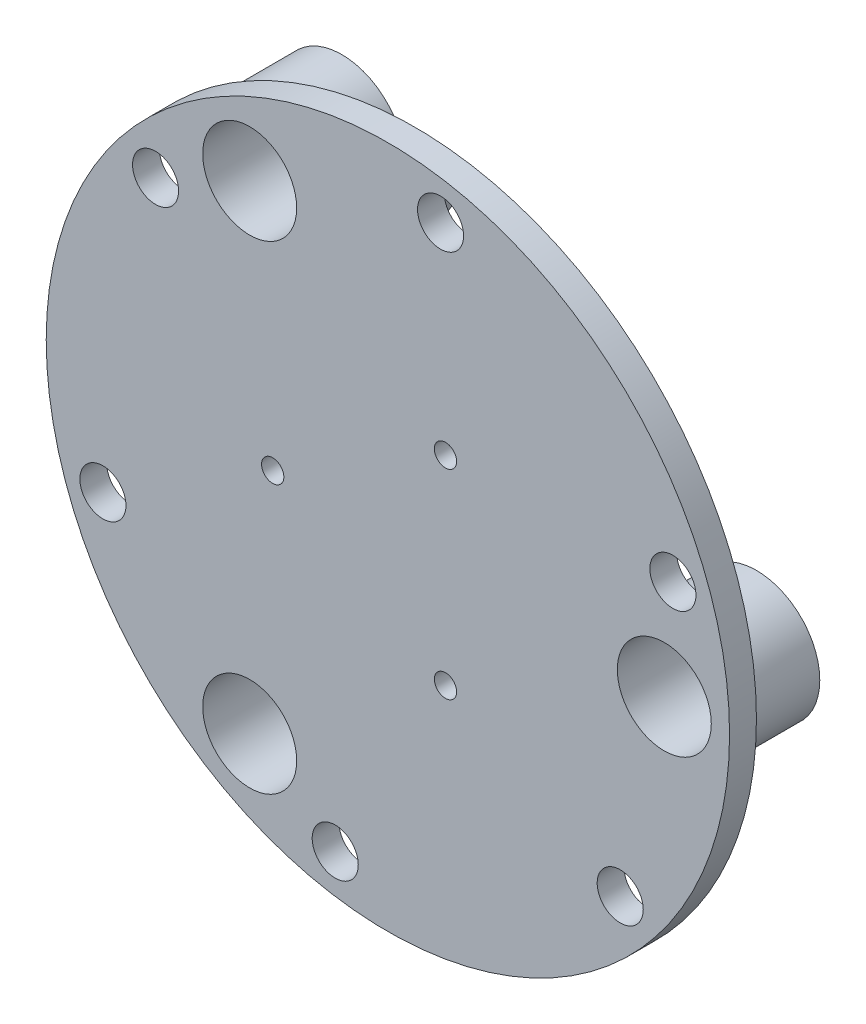
from build123d import *

# Parameters (mm, degrees)
F_01_START                                = 33.5
S01_JOINING_CENTRE_OF_FLOATING_Y_R        = 9
F_01_JOINING_CENTRE_OF_FLOATING_Y_DEPTH   = 3.5
F_02_START                                = 33.5
F_02_FLOATING_SPOKE_1_DEPTH               = 3.5
F_03_START                                = 33.5
F_03_FLOATING_SPOKE_2_DEPTH               = 3.5
F_04_START                                = 33.5
F_04_FLOATING_SPOKE_3_DEPTH               = 3.5
F_05_START                                = 33.5
F_05_MOVING_TENDON_TIE_WEB_1_DEPTH        = 3.5
F_06_START                                = 29.8
S06_TENDON_ANCHOR_BASE_1_R                = 4.2
F_06_TENDON_ANCHOR_BASE_1_DEPTH           = 3.7
F_07_START                                = 28
S07_TENDON_MOUTH_1_R                      = 3.15
F_07_TENDON_MOUTH_1_DEPTH                 = 1.8
F_08_START                                = 33.5
F_08_MOVING_TENDON_TIE_WEB_2_DEPTH        = 3.5
F_09_START                                = 29.8
S09_TENDON_ANCHOR_BASE_2_R                = 4.2
F_09_TENDON_ANCHOR_BASE_2_DEPTH           = 3.7
F_10_START                                = 28
S10_TENDON_MOUTH_2_R                      = 3.15
F_10_TENDON_MOUTH_2_DEPTH                 = 1.8
F_11_START                                = 33.5
F_11_MOVING_TENDON_TIE_WEB_3_DEPTH        = 3.5
F_12_START                                = 29.8
S12_TENDON_ANCHOR_BASE_3_R                = 4.2
F_12_TENDON_ANCHOR_BASE_3_DEPTH           = 3.7
F_13_START                                = 28
S13_TENDON_MOUTH_3_R                      = 3.15
F_13_TENDON_MOUTH_3_DEPTH                 = 1.8
F_14_START                                = 33.5
S14_JOINED_DRIVE_HOOP_R                   = 44.5
F_14_JOINED_DRIVE_HOOP_DEPTH              = 3.5
F_15_START                                = 25
S15_SLIDING_GUIDE_BARREL_1_R              = 8.25
F_15_SLIDING_GUIDE_BARREL_1_DEPTH         = 12
F_16_START                                = 25
S16_SLIDING_GUIDE_BARREL_2_R              = 8.25
F_16_SLIDING_GUIDE_BARREL_2_DEPTH         = 12
F_17_START                                = 25
S17_SLIDING_GUIDE_BARREL_3_R              = 8.25
F_17_SLIDING_GUIDE_BARREL_3_DEPTH         = 12
F_18_START                                = 24
S18_GUIDE_BUSHING_SEATS_R                 = 6.12
F_18_GUIDE_BUSHING_SEATS_DEPTH            = 14
F_19_START                                = 27.8
S19_THROUGH_TENDON_TIE_EYES_R             = 1.45
F_19_THROUGH_TENDON_TIE_EYES_DEPTH        = 10
F_20_START                                = -7.2
F_20_INTEGRAL_B1_FORK_CHEEK_L_DEPTH       = 3.6
F_21_START                                = 3.6
F_21_INTEGRAL_B1_FORK_CHEEK_R_DEPTH       = 3.6
F_22_START                                = -7.5
S22_B1_PIVOT_THROUGH_BOTH_CHEEKS_R        = 1.65
F_22_B1_PIVOT_THROUGH_BOTH_CHEEKS_DEPTH   = 15
F_23_START                                = -7.3
S23_B1_RECESSED_PIVOT_SCREW_HEAD_R        = 2.7
F_23_B1_RECESSED_PIVOT_SCREW_HEAD_DEPTH   = 1.5
F_24_START                                = -7.2
F_24_INTEGRAL_B2_FORK_CHEEK_L_DEPTH       = 3.6
F_25_START                                = 3.6
F_25_INTEGRAL_B2_FORK_CHEEK_R_DEPTH       = 3.6
F_26_START                                = -7.5
S26_B2_PIVOT_THROUGH_BOTH_CHEEKS_R        = 2.6
F_26_B2_PIVOT_THROUGH_BOTH_CHEEKS_DEPTH   = 15
F_27_START                                = -7.3
S27_B2_RECESSED_PIVOT_SCREW_HEAD_R        = 2.7
F_27_B2_RECESSED_PIVOT_SCREW_HEAD_DEPTH   = 1.5
F_28_START                                = -7.2
F_28_INTEGRAL_B3_FORK_CHEEK_L_DEPTH       = 3.6
F_29_START                                = 3.6
F_29_INTEGRAL_B3_FORK_CHEEK_R_DEPTH       = 3.6
F_30_START                                = -7.5
S30_B3_PIVOT_THROUGH_BOTH_CHEEKS_R        = 2.6
F_30_B3_PIVOT_THROUGH_BOTH_CHEEKS_DEPTH   = 15
F_31_START                                = -7.3
S31_B3_RECESSED_PIVOT_SCREW_HEAD_R        = 2.7
F_31_B3_RECESSED_PIVOT_SCREW_HEAD_DEPTH   = 1.5
CUT_EXTRUDE1_DEPTH                        = 74.425869509
CUT_EXTRUDE1_DEPTH_BACK                   = 16
SKETCH1_R                                 = 2.6
FORK_INNER_FACES_8_40_MM_LUG_CLEARANCE_BY = 0.6
FORK_INNER_FACES_8_40_MM_LUG_CLEAR_2_BY   = 0.6
FORK_INNER_FACES_8_40_MM_LUG_CLEAR_3_BY   = 0.6
FORK_INNER_FACES_8_40_MM_LUG_CLEAR_4_BY   = 0.6
FORK_INNER_FACES_8_40_MM_LUG_CLEAR_5_BY   = 0.6
FORK_INNER_FACES_8_40_MM_LUG_CLEAR_6_BY   = 0.6
SIX_START                                 = 37.1
SIX_6_MM_HOLES_ON_79_MM_PITCH_CIRCLE_R    = 3
SIX_LIGHTENING_HOLES_AT_60_DEGREES_DEPTH  = 3.7
CENTRAL_START                             = 30.55
CENTRAL_SIX_SIDED_RIB_JUNCTION_DEPTH      = 3


with BuildPart() as part:
    # S01 - Joining centre of floating Y → 01 - Joining centre of floating Y (new body)
    with BuildSketch(Plane.XY.offset(F_01_START)):
        Circle(S01_JOINING_CENTRE_OF_FLOATING_Y_R)
    extrude(amount=F_01_JOINING_CENTRE_OF_FLOATING_Y_DEPTH)

    # S02 - Floating spoke 1 → 02 - Floating spoke 1 (add)
    with BuildSketch(Plane.XY.offset(F_02_START)):
        with BuildLine():
            Line((4.65, -8.054036255), (-21.330762114, -23.054036255))
            ThreePointArc((-21.330762114, -23.054036255), (-34.034798369, -19.65), (-30.630762114, -6.945963745))
            Line((-30.630762114, -6.945963745), (-4.65, 8.054036255))
            ThreePointArc((-4.65, 8.054036255), (8.054036255, 4.65), (4.65, -8.054036255))
        make_face()
    extrude(amount=F_02_FLOATING_SPOKE_1_DEPTH)

    # S03 - Floating spoke 2 → 03 - Floating spoke 2 (add)
    with BuildSketch(Plane.XY.offset(F_03_START)):
        with BuildLine():
            Line((4.65, 8.054036255), (30.630762114, -6.945963745))
            ThreePointArc((30.630762114, -6.945963745), (34.034798369, -19.65), (21.330762114, -23.054036255))
            Line((21.330762114, -23.054036255), (-4.65, -8.054036255))
            ThreePointArc((-4.65, -8.054036255), (-8.054036255, 4.65), (4.65, 8.054036255))
        make_face()
    extrude(amount=F_03_FLOATING_SPOKE_2_DEPTH)

    # S04 - Floating spoke 3 → 04 - Floating spoke 3 (add)
    with BuildSketch(Plane.XY.offset(F_04_START)):
        with BuildLine():
            Line((-9.3, 0), (-9.3, 30))
            ThreePointArc((-9.3, 30), (0, 39.3), (9.3, 30))
            Line((9.3, 30), (9.3, 0))
            ThreePointArc((9.3, 0), (0, -9.3), (-9.3, 0))
        make_face()
    extrude(amount=F_04_FLOATING_SPOKE_3_DEPTH)

    # S05 - Moving tendon tie web 1 → 05 - Moving tendon tie web 1 (add)
    with BuildSketch(Plane.XY.offset(F_05_START)):
        with BuildLine():
            Line((25.299707774, -21.263079513), (6.818945661, -19.25346057))
            ThreePointArc((6.818945661, -19.25346057), (1.236920487, -12.309326717), (8.181054339, -6.727301544))
            Line((8.181054339, -6.727301544), (26.661816453, -8.736920487))
            ThreePointArc((26.661816453, -8.736920487), (32.243841627, -15.681054339), (25.299707774, -21.263079513))
        make_face()
    extrude(amount=F_05_MOVING_TENDON_TIE_WEB_1_DEPTH)

    # S06 - Tendon anchor base 1 → 06 - Tendon anchor base 1 (add)
    with BuildSketch(Plane.XY.offset(F_06_START)):
        with Locations((7.5, -12.990381057)):
            Circle(S06_TENDON_ANCHOR_BASE_1_R)
    extrude(amount=F_06_TENDON_ANCHOR_BASE_1_DEPTH)

    # S07 - Tendon mouth 1 → 07 - Tendon mouth 1 (add)
    with BuildSketch(Plane.XY.offset(F_07_START)):
        with Locations((7.5, -12.990381057)):
            Circle(S07_TENDON_MOUTH_1_R)
    extrude(amount=F_07_TENDON_MOUTH_1_DEPTH)

    # S08 - Moving tendon tie web 2 → 08 - Moving tendon tie web 2 (add)
    with BuildSketch(Plane.XY.offset(F_08_START)):
        with BuildLine():
            Line((5.764513134, 32.541729397), (13.264513134, 15.532110454))
            ThreePointArc((13.264513134, 15.532110454), (10.041729397, 7.225867923), (1.735486866, 10.448651659))
            Line((1.735486866, 10.448651659), (-5.764513134, 27.458270603))
            ThreePointArc((-5.764513134, 27.458270603), (-2.541729397, 35.764513134), (5.764513134, 32.541729397))
        make_face()
    extrude(amount=F_08_MOVING_TENDON_TIE_WEB_2_DEPTH)

    # S09 - Tendon anchor base 2 → 09 - Tendon anchor base 2 (add)
    with BuildSketch(Plane.XY.offset(F_09_START)):
        with Locations((7.5, 12.990381057)):
            Circle(S09_TENDON_ANCHOR_BASE_2_R)
    extrude(amount=F_09_TENDON_ANCHOR_BASE_2_DEPTH)

    # S10 - Tendon mouth 2 → 10 - Tendon mouth 2 (add)
    with BuildSketch(Plane.XY.offset(F_10_START)):
        with Locations((7.5, 12.990381057)):
            Circle(S10_TENDON_MOUTH_2_R)
    extrude(amount=F_10_TENDON_MOUTH_2_DEPTH)

    # S11 - Moving tendon tie web 3 → 11 - Moving tendon tie web 3 (add)
    with BuildSketch(Plane.XY.offset(F_11_START)):
        with BuildLine():
            Line((-31.064220908, -11.278649884), (-20.083458795, 3.721350116))
            ThreePointArc((-20.083458795, 3.721350116), (-11.278649884, 5.083458795), (-9.916541205, -3.721350116))
            Line((-9.916541205, -3.721350116), (-20.897303319, -18.721350116))
            ThreePointArc((-20.897303319, -18.721350116), (-29.702112229, -20.083458795), (-31.064220908, -11.278649884))
        make_face()
    extrude(amount=F_11_MOVING_TENDON_TIE_WEB_3_DEPTH)

    # S12 - Tendon anchor base 3 → 12 - Tendon anchor base 3 (add)
    with BuildSketch(Plane.XY.offset(F_12_START)):
        with Locations((-15, 0)):
            Circle(S12_TENDON_ANCHOR_BASE_3_R)
    extrude(amount=F_12_TENDON_ANCHOR_BASE_3_DEPTH)

    # S13 - Tendon mouth 3 → 13 - Tendon mouth 3 (add)
    with BuildSketch(Plane.XY.offset(F_13_START)):
        with Locations((-15, 0)):
            Circle(S13_TENDON_MOUTH_3_R)
    extrude(amount=F_13_TENDON_MOUTH_3_DEPTH)

    # S14 - Joined drive hoop → 14 - Joined drive hoop (add)
    with BuildSketch(Plane.XY.offset(F_14_START)):
        Circle(S14_JOINED_DRIVE_HOOP_R)
    extrude(amount=F_14_JOINED_DRIVE_HOOP_DEPTH)

    # S15 - Sliding guide barrel 1 → 15 - Sliding guide barrel 1 (add)
    with BuildSketch(Plane.XY.offset(F_15_START)):
        with Locations((36, 0)):
            Circle(S15_SLIDING_GUIDE_BARREL_1_R)
    extrude(amount=F_15_SLIDING_GUIDE_BARREL_1_DEPTH)

    # S16 - Sliding guide barrel 2 → 16 - Sliding guide barrel 2 (add)
    with BuildSketch(Plane.XY.offset(F_16_START)):
        with Locations((-18, 31.176914536)):
            Circle(S16_SLIDING_GUIDE_BARREL_2_R)
    extrude(amount=F_16_SLIDING_GUIDE_BARREL_2_DEPTH)

    # S17 - Sliding guide barrel 3 → 17 - Sliding guide barrel 3 (add)
    with BuildSketch(Plane.XY.offset(F_17_START)):
        with Locations((-18, -31.176914536)):
            Circle(S17_SLIDING_GUIDE_BARREL_3_R)
    extrude(amount=F_17_SLIDING_GUIDE_BARREL_3_DEPTH)

    # S18 - Guide bushing seats → 18 - Guide bushing seats (cut)
    with BuildSketch(Plane.XY.offset(F_18_START)):
        with Locations((36, 0)):
            Circle(S18_GUIDE_BUSHING_SEATS_R)
        with Locations((-18, 31.176914536)):
            Circle(S18_GUIDE_BUSHING_SEATS_R)
        with Locations((-18, -31.176914536)):
            Circle(S18_GUIDE_BUSHING_SEATS_R)
    extrude(amount=F_18_GUIDE_BUSHING_SEATS_DEPTH, mode=Mode.SUBTRACT)

    # S19 - Through tendon tie eyes → 19 - Through tendon tie eyes (cut)
    with BuildSketch(Plane.XY.offset(F_19_START)):
        with Locations((7.5, -12.990381057)):
            Circle(S19_THROUGH_TENDON_TIE_EYES_R)
        with Locations((7.5, 12.990381057)):
            Circle(S19_THROUGH_TENDON_TIE_EYES_R)
        with Locations((-15, 0)):
            Circle(S19_THROUGH_TENDON_TIE_EYES_R)
    extrude(amount=F_19_THROUGH_TENDON_TIE_EYES_DEPTH, mode=Mode.SUBTRACT)

    # S20 - Integral B1 fork cheek L → 20 - Integral B1 fork cheek L (add)
    with BuildSketch(Plane(origin=(2.009618943, -7.5, 0), x_dir=(0.9659258262890683, 0.2588190451025208, 0), z_dir=(-0.2588190451025208, 0.9659258262890684, 0)).offset(F_20_START)):
        with BuildLine():
            Line((-35.077774789, -34.5), (-22.877774789, -34.5))
            Line((-22.877774789, -34.5), (-24.027774789, -28))
            ThreePointArc((-24.027774789, -28), (-28.977774789, -23.05), (-33.927774789, -28))
            Line((-33.927774789, -28), (-35.077774789, -34.5))
        make_face()
    extrude(amount=F_20_INTEGRAL_B1_FORK_CHEEK_L_DEPTH)

    # S21 - Integral B1 fork cheek R → 21 - Integral B1 fork cheek R (add)
    with BuildSketch(Plane(origin=(2.009618943, -7.5, 0), x_dir=(0.9659258262890683, 0.2588190451025208, 0), z_dir=(-0.2588190451025208, 0.9659258262890684, 0)).offset(F_21_START)):
        with BuildLine():
            Line((-35.077774789, -34.5), (-22.877774789, -34.5))
            Line((-22.877774789, -34.5), (-24.027774789, -28))
            ThreePointArc((-24.027774789, -28), (-28.977774789, -23.05), (-33.927774789, -28))
            Line((-33.927774789, -28), (-35.077774789, -34.5))
        make_face()
    extrude(amount=F_21_INTEGRAL_B1_FORK_CHEEK_R_DEPTH)

    # S22 - B1 pivot through both cheeks → 22 - B1 pivot through both cheeks (cut)
    with BuildSketch(Plane(origin=(2.009618943, -7.5, 0), x_dir=(0.9659258262890683, 0.2588190451025208, 0), z_dir=(-0.2588190451025208, 0.9659258262890684, 0)).offset(F_22_START)):
        with Locations((-28.977774789, -28)):
            Circle(S22_B1_PIVOT_THROUGH_BOTH_CHEEKS_R)
    extrude(amount=F_22_B1_PIVOT_THROUGH_BOTH_CHEEKS_DEPTH, mode=Mode.SUBTRACT)

    # S23 - B1 recessed pivot screw head → 23 - B1 recessed pivot screw head (cut)
    with BuildSketch(Plane(origin=(2.009618943, -7.5, 0), x_dir=(0.9659258262890683, 0.2588190451025208, 0), z_dir=(-0.2588190451025208, 0.9659258262890684, 0)).offset(F_23_START)):
        with Locations((-28.977774789, -28)):
            Circle(S23_B1_RECESSED_PIVOT_SCREW_HEAD_R)
    extrude(amount=F_23_B1_RECESSED_PIVOT_SCREW_HEAD_DEPTH, mode=Mode.SUBTRACT)

    # S24 - Integral B2 fork cheek L → 24 - Integral B2 fork cheek L (add)
    with BuildSketch(Plane(origin=(5.490381057, 5.490381057, 0), x_dir=(0, 0, 1), z_dir=(-0.7071067811865476, -0.7071067811865475, 0)).offset(F_24_START)):
        with BuildLine():
            Line((34.5, -35.077774789), (34.5, -22.877774789))
            Line((34.5, -22.877774789), (28, -24.027774789))
            ThreePointArc((28, -24.027774789), (23.05, -28.977774789), (28, -33.927774789))
            Line((28, -33.927774789), (34.5, -35.077774789))
        make_face()
    extrude(amount=F_24_INTEGRAL_B2_FORK_CHEEK_L_DEPTH)

    # S25 - Integral B2 fork cheek R → 25 - Integral B2 fork cheek R (add)
    with BuildSketch(Plane(origin=(5.490381057, 5.490381057, 0), x_dir=(0, 0, 1), z_dir=(-0.7071067811865476, -0.7071067811865475, 0)).offset(F_25_START)):
        with BuildLine():
            Line((34.5, -35.077774789), (34.5, -22.877774789))
            Line((34.5, -22.877774789), (28, -24.027774789))
            ThreePointArc((28, -24.027774789), (23.05, -28.977774789), (28, -33.927774789))
            Line((28, -33.927774789), (34.5, -35.077774789))
        make_face()
    extrude(amount=F_25_INTEGRAL_B2_FORK_CHEEK_R_DEPTH)

    # S26 - B2 pivot through both cheeks → 26 - B2 pivot through both cheeks (cut)
    with BuildSketch(Plane(origin=(5.490381057, 5.490381057, 0), x_dir=(0, 0, 1), z_dir=(-0.7071067811865476, -0.7071067811865475, 0)).offset(F_26_START)):
        with Locations((28, -28.977774789)):
            Circle(S26_B2_PIVOT_THROUGH_BOTH_CHEEKS_R)
    extrude(amount=F_26_B2_PIVOT_THROUGH_BOTH_CHEEKS_DEPTH, mode=Mode.SUBTRACT)

    # S27 - B2 recessed pivot screw head → 27 - B2 recessed pivot screw head (cut)
    with BuildSketch(Plane(origin=(5.490381057, 5.490381057, 0), x_dir=(0, 0, 1), z_dir=(-0.7071067811865476, -0.7071067811865475, 0)).offset(F_27_START)):
        with Locations((28, -28.977774789)):
            Circle(S27_B2_RECESSED_PIVOT_SCREW_HEAD_R)
    extrude(amount=F_27_B2_RECESSED_PIVOT_SCREW_HEAD_DEPTH, mode=Mode.SUBTRACT)

    # S28 - Integral B3 fork cheek L → 28 - Integral B3 fork cheek L (add)
    with BuildSketch(Plane(origin=(-7.5, 2.009618943, 0), x_dir=(0, 0, -1), z_dir=(0.9659258262890683, -0.25881904510252113, 0)).offset(F_28_START)):
        with BuildLine():
            Line((-34.5, 35.077774789), (-34.5, 22.877774789))
            Line((-34.5, 22.877774789), (-28, 24.027774789))
            ThreePointArc((-28, 24.027774789), (-23.05, 28.977774789), (-28, 33.927774789))
            Line((-28, 33.927774789), (-34.5, 35.077774789))
        make_face()
    extrude(amount=F_28_INTEGRAL_B3_FORK_CHEEK_L_DEPTH)

    # S29 - Integral B3 fork cheek R → 29 - Integral B3 fork cheek R (add)
    with BuildSketch(Plane(origin=(-7.5, 2.009618943, 0), x_dir=(0, 0, -1), z_dir=(0.9659258262890683, -0.25881904510252113, 0)).offset(F_29_START)):
        with BuildLine():
            Line((-34.5, 35.077774789), (-34.5, 22.877774789))
            Line((-34.5, 22.877774789), (-28, 24.027774789))
            ThreePointArc((-28, 24.027774789), (-23.05, 28.977774789), (-28, 33.927774789))
            Line((-28, 33.927774789), (-34.5, 35.077774789))
        make_face()
    extrude(amount=F_29_INTEGRAL_B3_FORK_CHEEK_R_DEPTH)

    # S30 - B3 pivot through both cheeks → 30 - B3 pivot through both cheeks (cut)
    with BuildSketch(Plane(origin=(-7.5, 2.009618943, 0), x_dir=(0, 0, -1), z_dir=(0.9659258262890683, -0.25881904510252113, 0)).offset(F_30_START)):
        with Locations((-28, 28.977774789)):
            Circle(S30_B3_PIVOT_THROUGH_BOTH_CHEEKS_R)
    extrude(amount=F_30_B3_PIVOT_THROUGH_BOTH_CHEEKS_DEPTH, mode=Mode.SUBTRACT)

    # S31 - B3 recessed pivot screw head → 31 - B3 recessed pivot screw head (cut)
    with BuildSketch(Plane(origin=(-7.5, 2.009618943, 0), x_dir=(0, 0, -1), z_dir=(0.9659258262890683, -0.25881904510252113, 0)).offset(F_31_START)):
        with Locations((-28, 28.977774789)):
            Circle(S31_B3_RECESSED_PIVOT_SCREW_HEAD_R)
    extrude(amount=F_31_B3_RECESSED_PIVOT_SCREW_HEAD_DEPTH, mode=Mode.SUBTRACT)

    # Sketch1 → Cut-Extrude1 (cut, two sides: drawn at the far end of the back side and taken through both)
    with BuildSketch(Plane(origin=(0.146121818, -0.545334051, 0), x_dir=(0.9659258262890683, 0.25881904510252085, 0), z_dir=(-0.2588190451025208, 0.9659258262890682, 0)).offset(-CUT_EXTRUDE1_DEPTH_BACK)):
        with Locations((-28.977774789, -28)):
            Circle(SKETCH1_R)
    extrude(amount=CUT_EXTRUDE1_DEPTH + CUT_EXTRUDE1_DEPTH_BACK, mode=Mode.SUBTRACT)

    # Fork inner faces - 8.40 mm lug clearance: a face moved inward by 0.6
    extrude(part.faces().sort_by_distance((-25.049013551, -18.477332975, 30.8875))[0], amount=FORK_INNER_FACES_8_40_MM_LUG_CLEARANCE_BY, dir=(0.258819045, -0.965925826, 0), mode=Mode.SUBTRACT)

    # Fork inner faces - 8.40 mm lug clear 2: a face moved inward by 0.6
    extrude(part.faces().sort_by_distance((-26.912510676, -11.522667025, 30.8875))[0], amount=FORK_INNER_FACES_8_40_MM_LUG_CLEAR_2_BY, dir=(-0.258819045, 0.965925826, 0), mode=Mode.SUBTRACT)

    # Fork inner faces - 8.40 mm lug clear 3: a face moved inward by 0.6
    extrude(part.faces().sort_by_distance((30.620470455, -14.548539517, 28.275))[0], amount=FORK_INNER_FACES_8_40_MM_LUG_CLEAR_3_BY, dir=(0.707106781, 0.707106781, 0), mode=Mode.SUBTRACT)

    # Fork inner faces - 8.40 mm lug clear 4: a face moved inward by 0.6
    extrude(part.faces().sort_by_distance((25.52930163, -19.639708341, 28.275))[0], amount=FORK_INNER_FACES_8_40_MM_LUG_CLEAR_4_BY, dir=(-0.707106781, -0.707106781, 0), mode=Mode.SUBTRACT)

    # Fork inner faces - 8.40 mm lug clear 5: a face moved inward by 0.6
    extrude(part.faces().sort_by_distance((-4.243835531, 28.071122077, 28.275))[0], amount=FORK_INNER_FACES_8_40_MM_LUG_CLEAR_5_BY, dir=(-0.965925826, 0.258819045, 0), mode=Mode.SUBTRACT)

    # Fork inner faces - 8.40 mm lug clear 6: a face moved inward by 0.6
    extrude(part.faces().sort_by_distance((2.710830418, 26.207624952, 28.275))[0], amount=FORK_INNER_FACES_8_40_MM_LUG_CLEAR_6_BY, dir=(0.965925826, -0.258819045, 0), mode=Mode.SUBTRACT)

    # Six 6 mm holes on 79 mm pitch circle → Six lightening holes at 60 degrees (cut)
    with BuildSketch(Plane.XY.offset(SIX_START)):
        with Locations((37.117858521, 13.509795661)):
            Circle(SIX_6_MM_HOLES_ON_79_MM_PITCH_CIRCLE_R)
        with Locations((6.859103018, 38.899906244)):
            Circle(SIX_6_MM_HOLES_ON_79_MM_PITCH_CIRCLE_R)
        with Locations((-30.258755503, 25.390110583)):
            Circle(SIX_6_MM_HOLES_ON_79_MM_PITCH_CIRCLE_R)
        with Locations((-37.117858521, -13.509795661)):
            Circle(SIX_6_MM_HOLES_ON_79_MM_PITCH_CIRCLE_R)
        with Locations((-6.859103018, -38.899906244)):
            Circle(SIX_6_MM_HOLES_ON_79_MM_PITCH_CIRCLE_R)
        with Locations((30.258755503, -25.390110583)):
            Circle(SIX_6_MM_HOLES_ON_79_MM_PITCH_CIRCLE_R)
    extrude(amount=-SIX_LIGHTENING_HOLES_AT_60_DEGREES_DEPTH, mode=Mode.SUBTRACT)

    # Central hub - 11 mm across flats → Central six-sided rib junction (add)
    with BuildSketch(Plane.XY.offset(CENTRAL_START)):
        Polygon((5.5, 3.175426481), (0, 6.350852961), (-5.5, 3.175426481), (-5.5, -3.175426481), (0, -6.350852961), (5.5, -3.175426481), align=None)
    extrude(amount=CENTRAL_SIX_SIDED_RIB_JUNCTION_DEPTH)

    # Guide 1 radial trapezoidal rib - root → Guide 1 radial trapezoidal rib section 0
    with BuildSketch(Plane(origin=(4.85, -2.25, 33.55), x_dir=(0, 0.8011814241315997, -0.5984215283781675), z_dir=(1, 0, 0))):
        with BuildLine():
            Line((0, 0), (3.605316409, 2.692896878))
            Line((3.605316409, 2.692896878), (4.96305674, 0))
            Line((4.96305674, 0), (2.196883547, -2.066120782))
            Line((2.196883547, -2.066120782), (0, 0))
        make_face()
    # Guide 1 radial trapezoidal rib - tip → Guide 1 radial trapezoidal rib section 1
    with BuildSketch(Plane(origin=(29.15, -2.7, 33.55), x_dir=(0, 0.5044526883330976, -0.8634393350047882), z_dir=(1, 0, 0))):
        with BuildLine():
            Line((0, 0), (2.724044517, 4.662572409))
            Line((2.724044517, 4.662572409), (8.222928597, 0))
            Line((8.222928597, 0), (6.761954477, -2.500655765))
            Line((6.761954477, -2.500655765), (0, 0))
        make_face()
    loft()

    # Tendon 1 radial trapezoidal rib - root → Tendon 1 radial trapezoidal rib section 0
    with BuildSketch(Plane(origin=(4.027146997, 3.275223208, 33.55), x_dir=(-0.6325712569152563, 0.36521518546164355, -0.6829871691568372), z_dir=(0.5000000000000003, 0.8660254037844385, 0))):
        with BuildLine():
            Line((0, 0), (2.702592372, 2.527052526))
            Line((2.702592372, 2.527052526), (4.348544357, 0))
            Line((4.348544357, 0), (2.410991801, -1.811703877))
            Line((2.410991801, -1.811703877), (0, 0))
        make_face()
    # Tendon 1 radial trapezoidal rib - tip → Tendon 1 radial trapezoidal rib section 1
    with BuildSketch(Plane(origin=(7.770448267, 9.658811196, 33.55), x_dir=(-0.6024162615456616, 0.34780519076759553, -0.7184192349182097), z_dir=(0.4999999999999997, 0.8660254037844388, 0))):
        with BuildLine():
            Line((0, 0), (2.64331945, 2.729993093))
            Line((2.64331945, 2.729993093), (4.621257114, 0))
            Line((4.621257114, 0), (2.792366056, -1.888859841))
            Line((2.792366056, -1.888859841), (0, 0))
        make_face()
    loft()

    # Guide 2 radial trapezoidal rib - root → Guide 2 radial trapezoidal rib section 0
    with BuildSketch(Plane(origin=(-0.476442841, 5.325223208, 33.55), x_dir=(-0.6938434663381602, -0.40059071206579977, -0.5984215283781676), z_dir=(-0.49999999999999983, 0.8660254037844387, 0))):
        with BuildLine():
            Line((0, 0), (3.605316409, 2.692896878))
            Line((3.605316409, 2.692896878), (4.96305674, 0))
            Line((4.96305674, 0), (2.196883547, -2.066120782))
            Line((2.196883547, -2.066120782), (0, 0))
        make_face()
    # Guide 2 radial trapezoidal rib - tip → Guide 2 radial trapezoidal rib section 1
    with BuildSketch(Plane(origin=(-12.23673141, 26.59464052, 33.55), x_dir=(-0.4368688431038167, -0.25222634416654865, -0.8634393350047881), z_dir=(-0.4999999999999996, 0.8660254037844389, 0))):
        with BuildLine():
            Line((0, 0), (2.724044517, 4.662572409))
            Line((2.724044517, 4.662572409), (8.222928597, 0))
            Line((8.222928597, 0), (6.761954477, -2.500655765))
            Line((6.761954477, -2.500655765), (0, 0))
        make_face()
    loft()

    # Tendon 2 radial trapezoidal rib - root → Tendon 2 radial trapezoidal rib section 0
    with BuildSketch(Plane(origin=(-4.85, 1.85, 33.55), x_dir=(0, -0.7304303709232866, -0.6829871691568371), z_dir=(-1, 0, 0))):
        with BuildLine():
            Line((0, 0), (2.702592372, 2.527052526))
            Line((2.702592372, 2.527052526), (4.348544357, 0))
            Line((4.348544357, 0), (2.410991801, -1.811703877))
            Line((2.410991801, -1.811703877), (0, 0))
        make_face()
    # Tendon 2 radial trapezoidal rib - tip → Tendon 2 radial trapezoidal rib section 1
    with BuildSketch(Plane(origin=(-12.25, 1.9, 33.55), x_dir=(0, -0.6956103815351913, -0.7184192349182096), z_dir=(-1, 0, 0))):
        with BuildLine():
            Line((0, 0), (2.64331945, 2.729993093))
            Line((2.64331945, 2.729993093), (4.621257114, 0))
            Line((4.621257114, 0), (2.792366056, -1.888859841))
            Line((2.792366056, -1.888859841), (0, 0))
        make_face()
    loft()

    # Guide 3 radial trapezoidal rib - root → Guide 3 radial trapezoidal rib section 0
    with BuildSketch(Plane(origin=(-4.373557159, -3.075223208, 33.55), x_dir=(0.69384346633816, -0.4005907120658002, -0.5984215283781676), z_dir=(-0.5000000000000004, -0.8660254037844385, 0))):
        with BuildLine():
            Line((0, 0), (3.605316409, 2.692896878))
            Line((3.605316409, 2.692896878), (4.96305674, 0))
            Line((4.96305674, 0), (2.196883547, -2.066120782))
            Line((2.196883547, -2.066120782), (0, 0))
        make_face()
    # Guide 3 radial trapezoidal rib - tip → Guide 3 radial trapezoidal rib section 1
    with BuildSketch(Plane(origin=(-16.91326859, -23.89464052, 33.55), x_dir=(0.4368688431038163, -0.25222634416654915, -0.8634393350047881), z_dir=(-0.5000000000000009, -0.8660254037844382, 0))):
        with BuildLine():
            Line((0, 0), (2.724044517, 4.662572409))
            Line((2.724044517, 4.662572409), (8.222928597, 0))
            Line((8.222928597, 0), (6.761954477, -2.500655765))
            Line((6.761954477, -2.500655765), (0, 0))
        make_face()
    loft()

    # Tendon 3 radial trapezoidal rib - root → Tendon 3 radial trapezoidal rib section 0
    with BuildSketch(Plane(origin=(0.822853003, -5.125223208, 33.55), x_dir=(0.6325712569152565, 0.36521518546164344, -0.6829871691568372), z_dir=(0.5000000000000003, -0.8660254037844385, 0))):
        with BuildLine():
            Line((0, 0), (2.702592372, 2.527052526))
            Line((2.702592372, 2.527052526), (4.348544357, 0))
            Line((4.348544357, 0), (2.410991801, -1.811703877))
            Line((2.410991801, -1.811703877), (0, 0))
        make_face()
    # Tendon 3 radial trapezoidal rib - tip → Tendon 3 radial trapezoidal rib section 1
    with BuildSketch(Plane(origin=(4.479551733, -11.558811196, 33.55), x_dir=(0.6024162615456616, 0.34780519076759553, -0.7184192349182097), z_dir=(0.4999999999999997, -0.8660254037844388, 0))):
        with BuildLine():
            Line((0, 0), (2.64331945, 2.729993093))
            Line((2.64331945, 2.729993093), (4.621257114, 0))
            Line((4.621257114, 0), (2.792366056, -1.888859841))
            Line((2.792366056, -1.888859841), (0, 0))
        make_face()
    loft()


solid = part.part
